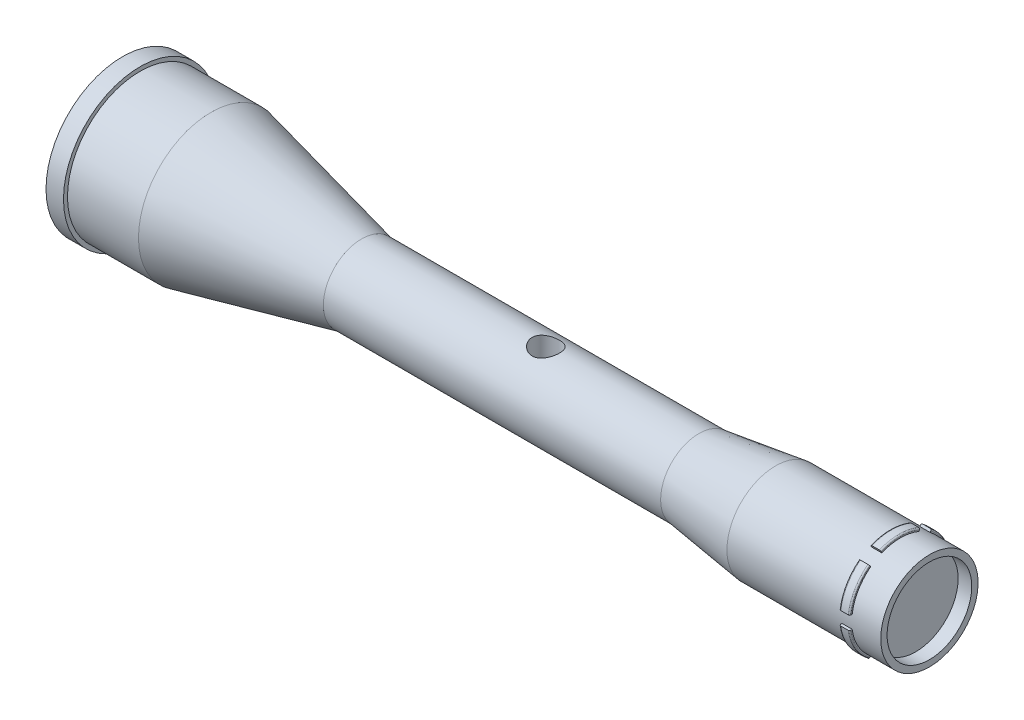
from build123d import *

# Parameters (mm, degrees)
BOSS_EXTRUDE1_DEPTH     = 3.73
BOSS_EXTRUDE1_2_DEPTH   = 3.73
BOSS_EXTRUDE1_3_DEPTH   = 3.73
BOSS_EXTRUDE1_4_DEPTH   = 3.73
BOSS_EXTRUDE1_5_DEPTH   = 3.73
BOSS_EXTRUDE1_6_DEPTH   = 3.73
FILLET1_R               = 0.5
FILLET2_R               = 0.5
FILLET3_R               = 0.5
FILLET4_R               = 0.5
FILLET5_R               = 0.5
FILLET6_R               = 0.5
CUT_EXTRUDE1_DEPTH      = 153.973408637
CUT_EXTRUDE1_DEPTH_BACK = 153.973408637
SKETCH3_R               = 5
SKETCH4_R               = 25.25
CUT_EXTRUDE2_DEPTH      = 5
SKETCH5_R               = 15.5
CUT_EXTRUDE3_DEPTH      = 5


with BuildPart() as part:
    # Sketch1 → Revolve1 (revolve)
    with BuildSketch(Plane(origin=(0, 0, 0), x_dir=(1, 0, 0), z_dir=(0, 1, 0))):
        Polygon((-147.75, 0), (-147.75, 28.025), (-141.35, 28.025), (-141.35, 26.56), (-115.35, 26.56), (-60.19, 14), (63.31, 14), (91.41, 17.82), (147.75, 17.82), (147.75, 0), align=None)
    revolve(axis=Axis((-147.75, 0, 0), (1, 0, 0)))

    # Sketch3 → Cut-Extrude1 (cut, two sides: drawn at the far end of the back side and taken through both)
    with BuildSketch(Plane(origin=(0, 0, 0), x_dir=(1, 0, 0), z_dir=(0, 1, 0)).offset(-CUT_EXTRUDE1_DEPTH_BACK)):
        with Locations((7.27, 0)):
            Circle(SKETCH3_R)
    extrude(amount=CUT_EXTRUDE1_DEPTH + CUT_EXTRUDE1_DEPTH_BACK, mode=Mode.SUBTRACT)

    # Sketch4 → Cut-Extrude2 (cut)
    with BuildSketch(Plane.ZY.offset(147.75)):
        Circle(SKETCH4_R)
    extrude(amount=-CUT_EXTRUDE2_DEPTH, mode=Mode.SUBTRACT)

    # Sketch5 → Cut-Extrude3 (cut)
    with BuildSketch(Plane(origin=(147.75, 0, 0), x_dir=(0, 0, -1), z_dir=(1, 0, 0))):
        Circle(SKETCH5_R)
    extrude(amount=-CUT_EXTRUDE3_DEPTH, mode=Mode.SUBTRACT)


with BuildPart() as body_2:
    # Sketch2 → Boss-Extrude1 (new body)
    with BuildSketch(Plane(origin=(137.11, 0, 0), x_dir=(0, 0, -1), z_dir=(1, 0, 0))):
        with BuildLine():
            Line((-7.175314357, 17.322741235), (-6.819418765, 16.463533269))
            ThreePointArc((-6.819418765, 16.463533269), (0, 17.82), (6.819418765, 16.463533269))
            Line((6.819418765, 16.463533269), (7.175314357, 17.322741235))
            ThreePointArc((7.175314357, 17.322741235), (0, 18.75), (-7.175314357, 17.322741235))
        make_face()
    extrude(amount=-BOSS_EXTRUDE1_DEPTH)

    # Fillet2
    fillet2_edges = [body_2.edges().sort_by_distance(p)[0] for p in [
        (133.38, 18.75, 0),
        (137.11, 18.75, 0),
    ]]
    fillet(fillet2_edges, radius=FILLET2_R)


with BuildPart() as body_3:
    # Sketch2 → Boss-Extrude1 2 (new body)
    with BuildSketch(Plane(origin=(137.11, 0, 0), x_dir=(0, 0, -1), z_dir=(1, 0, 0))):
        with BuildLine():
            Line((11.414276794, 14.87537513), (10.848128665, 14.137556524))
            ThreePointArc((10.848128665, 14.137556524), (15.432572695, 8.91), (17.66754743, 2.325976745))
            Line((17.66754743, 2.325976745), (18.589591151, 2.447366104))
            ThreePointArc((18.589591151, 2.447366104), (16.237976321, 9.375), (11.414276794, 14.87537513))
        make_face()
    extrude(amount=-BOSS_EXTRUDE1_2_DEPTH)

    # Fillet1
    fillet1_edges = [body_3.edges().sort_by_distance(p)[0] for p in [
        (133.38, 9.375, -16.237976321),
        (137.11, 9.375, -16.237976321),
    ]]
    fillet(fillet1_edges, radius=FILLET1_R)


with BuildPart() as body_4:
    # Sketch2 → Boss-Extrude1 3 (new body)
    with BuildSketch(Plane(origin=(137.11, 0, 0), x_dir=(0, 0, -1), z_dir=(1, 0, 0))):
        with BuildLine():
            Line((18.589591151, -2.447366104), (17.66754743, -2.325976745))
            ThreePointArc((17.66754743, -2.325976745), (15.432572695, -8.91), (10.848128665, -14.137556524))
            Line((10.848128665, -14.137556524), (11.414276794, -14.87537513))
            ThreePointArc((11.414276794, -14.87537513), (16.237976321, -9.375), (18.589591151, -2.447366104))
        make_face()
    extrude(amount=-BOSS_EXTRUDE1_3_DEPTH)

    # Fillet6
    fillet6_edges = [body_4.edges().sort_by_distance(p)[0] for p in [
        (137.11, -9.375, -16.237976321),
        (133.38, -9.375, -16.237976321),
    ]]
    fillet(fillet6_edges, radius=FILLET6_R)


with BuildPart() as body_5:
    # Sketch2 → Boss-Extrude1 4 (new body)
    with BuildSketch(Plane(origin=(137.11, 0, 0), x_dir=(0, 0, -1), z_dir=(1, 0, 0))):
        with BuildLine():
            Line((7.175314357, -17.322741235), (6.819418765, -16.463533269))
            ThreePointArc((6.819418765, -16.463533269), (0, -17.82), (-6.819418765, -16.463533269))
            Line((-6.819418765, -16.463533269), (-7.175314357, -17.322741235))
            ThreePointArc((-7.175314357, -17.322741235), (0, -18.75), (7.175314357, -17.322741235))
        make_face()
    extrude(amount=-BOSS_EXTRUDE1_4_DEPTH)

    # Fillet5
    fillet5_edges = [body_5.edges().sort_by_distance(p)[0] for p in [
        (137.11, -18.75, 0),
        (133.38, -18.75, 0),
    ]]
    fillet(fillet5_edges, radius=FILLET5_R)


with BuildPart() as body_6:
    # Sketch2 → Boss-Extrude1 5 (new body)
    with BuildSketch(Plane(origin=(137.11, 0, 0), x_dir=(0, 0, -1), z_dir=(1, 0, 0))):
        with BuildLine():
            Line((-11.414276794, -14.87537513), (-10.848128665, -14.137556524))
            ThreePointArc((-10.848128665, -14.137556524), (-15.432572695, -8.91), (-17.66754743, -2.325976745))
            Line((-17.66754743, -2.325976745), (-18.589591151, -2.447366104))
            ThreePointArc((-18.589591151, -2.447366104), (-16.237976321, -9.375), (-11.414276794, -14.87537513))
        make_face()
    extrude(amount=-BOSS_EXTRUDE1_5_DEPTH)

    # Fillet4
    fillet4_edges = [body_6.edges().sort_by_distance(p)[0] for p in [
        (133.38, -9.375, 16.237976321),
        (137.11, -9.375, 16.237976321),
    ]]
    fillet(fillet4_edges, radius=FILLET4_R)


with BuildPart() as body_7:
    # Sketch2 → Boss-Extrude1 6 (new body)
    with BuildSketch(Plane(origin=(137.11, 0, 0), x_dir=(0, 0, -1), z_dir=(1, 0, 0))):
        with BuildLine():
            Line((-18.589591151, 2.447366104), (-17.66754743, 2.325976745))
            ThreePointArc((-17.66754743, 2.325976745), (-15.432572695, 8.91), (-10.848128665, 14.137556524))
            Line((-10.848128665, 14.137556524), (-11.414276794, 14.87537513))
            ThreePointArc((-11.414276794, 14.87537513), (-16.237976321, 9.375), (-18.589591151, 2.447366104))
        make_face()
    extrude(amount=-BOSS_EXTRUDE1_6_DEPTH)

    # Fillet3
    fillet3_edges = [body_7.edges().sort_by_distance(p)[0] for p in [
        (133.38, 9.375, 16.237976321),
        (137.11, 9.375, 16.237976321),
    ]]
    fillet(fillet3_edges, radius=FILLET3_R)


solid = Compound([part.part, body_2.part, body_3.part, body_4.part, body_5.part, body_6.part, body_7.part])
